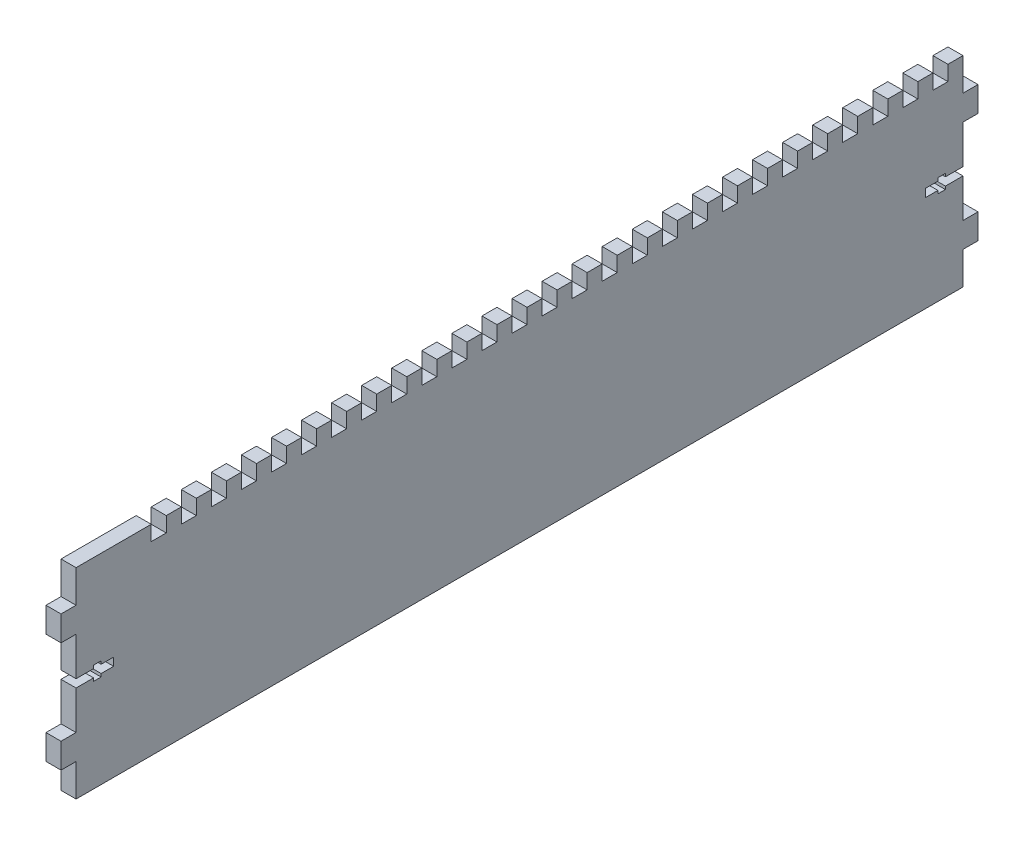
from build123d import *

# Parameters (mm, degrees)
SKETCH1_W           = 354
SKETCH1_H           = 80
BOSS_EXTRUDE1_DEPTH = 6
SKETCH3_W           = 6
SKETCH3_H           = 6
CUT_EXTRUDE2_DEPTH  = 6
SKETCH4_W           = 6
SKETCH4_H           = 10
BOSS_EXTRUDE2_DEPTH = 6
CUT_EXTRUDE3_REACH  = 189.417
SKETCH7_W           = 6
SKETCH7_H           = 10
BOSS_EXTRUDE3_DEPTH = 6


with BuildPart() as part:
    # Sketch1 → Boss-Extrude1 (new body)
    with BuildSketch(Plane(origin=(0, 0, 0), x_dir=(0, 0, -1), z_dir=(1, 0, 0))):
        Rectangle(SKETCH1_W, SKETCH1_H)
    extrude(amount=BOSS_EXTRUDE1_DEPTH)

    # Sketch3 → Cut-Extrude2 (cut)
    with BuildSketch(Plane(origin=(0, 40, 0), x_dir=(1, 0, 0), z_dir=(0, 1, 0))):
        with Locations((3, -144)):
            Rectangle(SKETCH3_W, SKETCH3_H)
        with Locations((3, -132)):
            Rectangle(SKETCH3_W, SKETCH3_H)
        with Locations((3, -120)):
            Rectangle(SKETCH3_W, SKETCH3_H)
        with Locations((3, -108)):
            Rectangle(SKETCH3_W, SKETCH3_H)
        with Locations((3, -96)):
            Rectangle(SKETCH3_W, SKETCH3_H)
        with Locations((3, -84)):
            Rectangle(SKETCH3_W, SKETCH3_H)
        with Locations((3, -72)):
            Rectangle(SKETCH3_W, SKETCH3_H)
        with Locations((3, -60)):
            Rectangle(SKETCH3_W, SKETCH3_H)
        with Locations((3, -48)):
            Rectangle(SKETCH3_W, SKETCH3_H)
        with Locations((3, -36)):
            Rectangle(SKETCH3_W, SKETCH3_H)
        with Locations((3, -24)):
            Rectangle(SKETCH3_W, SKETCH3_H)
        with Locations((3, -12)):
            Rectangle(SKETCH3_W, SKETCH3_H)
        with Locations((3, 0)):
            Rectangle(SKETCH3_W, SKETCH3_H)
        with Locations((3, 12)):
            Rectangle(SKETCH3_W, SKETCH3_H)
        with Locations((3, 24)):
            Rectangle(SKETCH3_W, SKETCH3_H)
        with Locations((3, 36)):
            Rectangle(SKETCH3_W, SKETCH3_H)
        with Locations((3, 48)):
            Rectangle(SKETCH3_W, SKETCH3_H)
        with Locations((3, 60)):
            Rectangle(SKETCH3_W, SKETCH3_H)
        with Locations((3, 72)):
            Rectangle(SKETCH3_W, SKETCH3_H)
        with Locations((3, 84)):
            Rectangle(SKETCH3_W, SKETCH3_H)
        with Locations((3, 96)):
            Rectangle(SKETCH3_W, SKETCH3_H)
        with Locations((3, 108)):
            Rectangle(SKETCH3_W, SKETCH3_H)
        with Locations((3, 120)):
            Rectangle(SKETCH3_W, SKETCH3_H)
        with Locations((3, 132)):
            Rectangle(SKETCH3_W, SKETCH3_H)
        with Locations((3, 144)):
            Rectangle(SKETCH3_W, SKETCH3_H)
        with Locations((3, 156)):
            Rectangle(SKETCH3_W, SKETCH3_H)
        with Locations((3, 168)):
            Rectangle(SKETCH3_W, SKETCH3_H)
    extrude(amount=-CUT_EXTRUDE2_DEPTH, mode=Mode.SUBTRACT)

    # Sketch4 → Boss-Extrude2 (add)
    with BuildSketch(Plane.XY.offset(177)):
        with Locations((3, 22)):
            Rectangle(SKETCH4_W, SKETCH4_H)
        with Locations((3, -22)):
            Rectangle(SKETCH4_W, SKETCH4_H)
    extrude(amount=BOSS_EXTRUDE2_DEPTH)

    # Sketch5 → Cut-Extrude3 (cut, up to next)
    with BuildSketch(Plane.ZY, mode=Mode.PRIVATE) as cut_extrude3_sk1:
        Polygon((-170, 1.6), (-177, 1.6), (-177, -1.6), (-170, -1.6), (-170, -2.8), (-167, -2.8), (-167, -1.6), (-162, -1.6), (-162, 1.6), (-167, 1.6), (-167, 2.8), (-170, 2.8), align=None)
    cut_extrude3_tool1 = extrude(cut_extrude3_sk1.sketch, amount=-CUT_EXTRUDE3_REACH, mode=Mode.PRIVATE) & part.part
    # Sketch5 → Cut-Extrude3 (cut, up to next)
    with BuildSketch(Plane.ZY, mode=Mode.PRIVATE) as cut_extrude3_sk2:
        Polygon((170, -1.6), (177, -1.6), (177, 1.6), (170, 1.6), (170, 2.8), (167, 2.8), (167, 1.6), (162, 1.6), (162, -1.6), (167, -1.6), (167, -2.8), (170, -2.8), align=None)
    cut_extrude3_tool2 = extrude(cut_extrude3_sk2.sketch, amount=-CUT_EXTRUDE3_REACH, mode=Mode.PRIVATE) & part.part
    add(cut_extrude3_tool1.solids().sort_by_distance((0, 0, -169.369565))[0], mode=Mode.SUBTRACT)
    add(cut_extrude3_tool2.solids().sort_by_distance((0, 0, 169.369565))[0], mode=Mode.SUBTRACT)

    # Sketch7 → Boss-Extrude3 (add)
    with BuildSketch(Plane(origin=(0, 0, -177), x_dir=(-1, 0, 0), z_dir=(0, 0, -1))):
        with Locations((-3, 22)):
            Rectangle(SKETCH7_W, SKETCH7_H)
        with Locations((-3, -22)):
            Rectangle(SKETCH7_W, SKETCH7_H)
    extrude(amount=BOSS_EXTRUDE3_DEPTH)


solid = part.part
